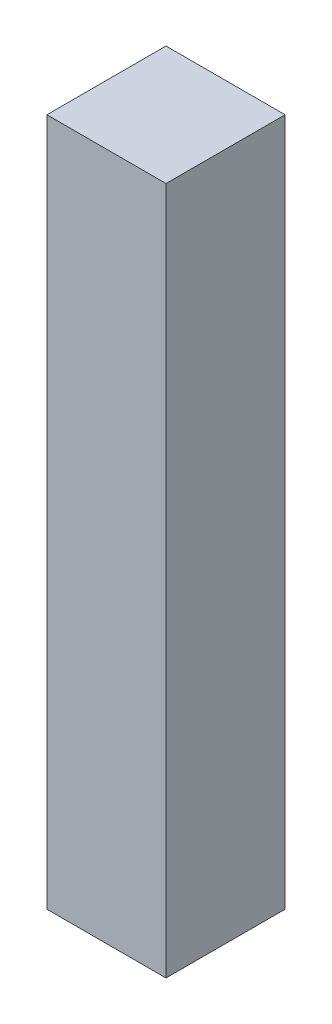
from build123d import *

# Parameters (mm, degrees)
SKETCH1_W           = 114.3
SKETCH1_H           = 114.3
BOSS_EXTRUDE1_DEPTH = 660.4
SKETCH2_R           = 3.96875
CUT_EXTRUDE1_DEPTH  = 25.4


with BuildPart() as part:
    # Sketch1 → Boss-Extrude1 (new body)
    with BuildSketch(Plane(origin=(0, 0, 0), x_dir=(1, 0, 0), z_dir=(0, 1, 0))):
        Rectangle(SKETCH1_W, SKETCH1_H)
    extrude(amount=BOSS_EXTRUDE1_DEPTH)

    # Sketch2 → Cut-Extrude1 (cut)
    with BuildSketch(Plane(origin=(0, 0, 0), x_dir=(1, 0, 0), z_dir=(0, 1, 0))):
        Circle(SKETCH2_R)
    extrude(amount=CUT_EXTRUDE1_DEPTH, mode=Mode.SUBTRACT)


solid = part.part
